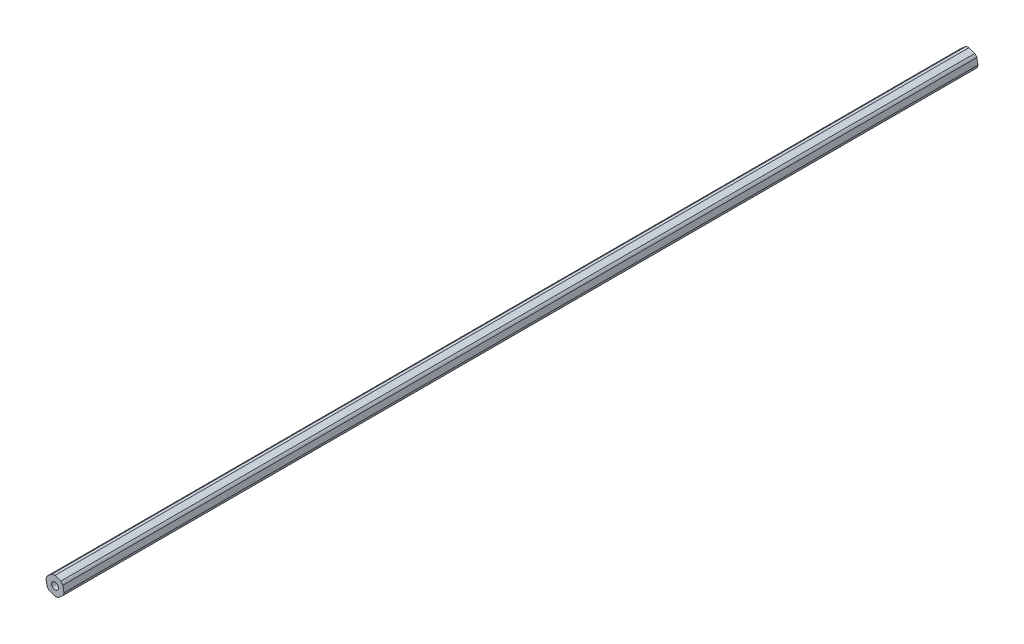
from build123d import *

# Parameters (mm, degrees)
BOSS_EXTRUDE1_DEPTH         = 678.3197
SKETCH2_R                   = 2.0193
CUT_EXTRUDE1_DEPTH          = 679.385923219
F_1_4_20_TAPPED_HOLE1_D     = 5.1054
F_1_4_20_TAPPED_HOLE1_DEPTH = 19.05
F_1_4_20_TAPPED_HOLE1_TIP   = 1.533816902
F_1_4_20_TAPPED_HOLE2_D     = 5.1054
F_1_4_20_TAPPED_HOLE2_DEPTH = 19.05
F_1_4_20_TAPPED_HOLE2_TIP   = 1.533816902


with BuildPart() as part:
    # Sketch1 → Boss-Extrude1 (new body)
    with BuildSketch(Plane.XY):
        with BuildLine():
            Line((-6.654540832, 1.131188008), (-5.845671476, -3.375))
            ThreePointArc((-5.845671476, -3.375), (-5.15742276, -4.354709), (-4.306907968, -5.197407407))
            Line((-4.306907968, -5.197407407), (0, -6.75))
            ThreePointArc((0, -6.75), (1.19257724, -6.643813628), (2.347632865, -6.328595415))
            Line((2.347632865, -6.328595415), (5.845671476, -3.375))
            ThreePointArc((5.845671476, -3.375), (6.35, -2.289104628), (6.654540832, -1.131188008))
            Line((6.654540832, -1.131188008), (5.845671476, 3.375))
            ThreePointArc((5.845671476, 3.375), (5.15742276, 4.354709), (4.306907968, 5.197407407))
            Line((4.306907968, 5.197407407), (0, 6.75))
            ThreePointArc((0, 6.75), (-1.19257724, 6.643813628), (-2.347632865, 6.328595415))
            Line((-2.347632865, 6.328595415), (-5.845671476, 3.375))
            ThreePointArc((-5.845671476, 3.375), (-6.35, 2.289104628), (-6.654540832, 1.131188008))
        make_face()
    extrude(amount=BOSS_EXTRUDE1_DEPTH)

    # Sketch2 → Cut-Extrude1 (cut, through all)
    with BuildSketch(Plane.XY.offset(678.3197)):
        Circle(SKETCH2_R)
    extrude(amount=-CUT_EXTRUDE1_DEPTH, mode=Mode.SUBTRACT)

    # 1/4-20 Tapped Hole1
    with Locations(Plane.XY.offset(678.3197)):
        with Locations((0, 0)):
            Hole(F_1_4_20_TAPPED_HOLE1_D / 2, depth=F_1_4_20_TAPPED_HOLE1_DEPTH)
            with Locations((0, 0, -(F_1_4_20_TAPPED_HOLE1_DEPTH + F_1_4_20_TAPPED_HOLE1_TIP / 2))):  # 118° drill point
                Cone(0, F_1_4_20_TAPPED_HOLE1_D / 2, F_1_4_20_TAPPED_HOLE1_TIP, mode=Mode.SUBTRACT)

    # 1/4-20 Tapped Hole2
    with Locations(Plane(origin=(0, 0, 0), x_dir=(-1, 0, 0), z_dir=(0, 0, -1))):
        with Locations((0, 0)):
            Hole(F_1_4_20_TAPPED_HOLE2_D / 2, depth=F_1_4_20_TAPPED_HOLE2_DEPTH)
            with Locations((0, 0, -(F_1_4_20_TAPPED_HOLE2_DEPTH + F_1_4_20_TAPPED_HOLE2_TIP / 2))):  # 118° drill point
                Cone(0, F_1_4_20_TAPPED_HOLE2_D / 2, F_1_4_20_TAPPED_HOLE2_TIP, mode=Mode.SUBTRACT)


solid = part.part
